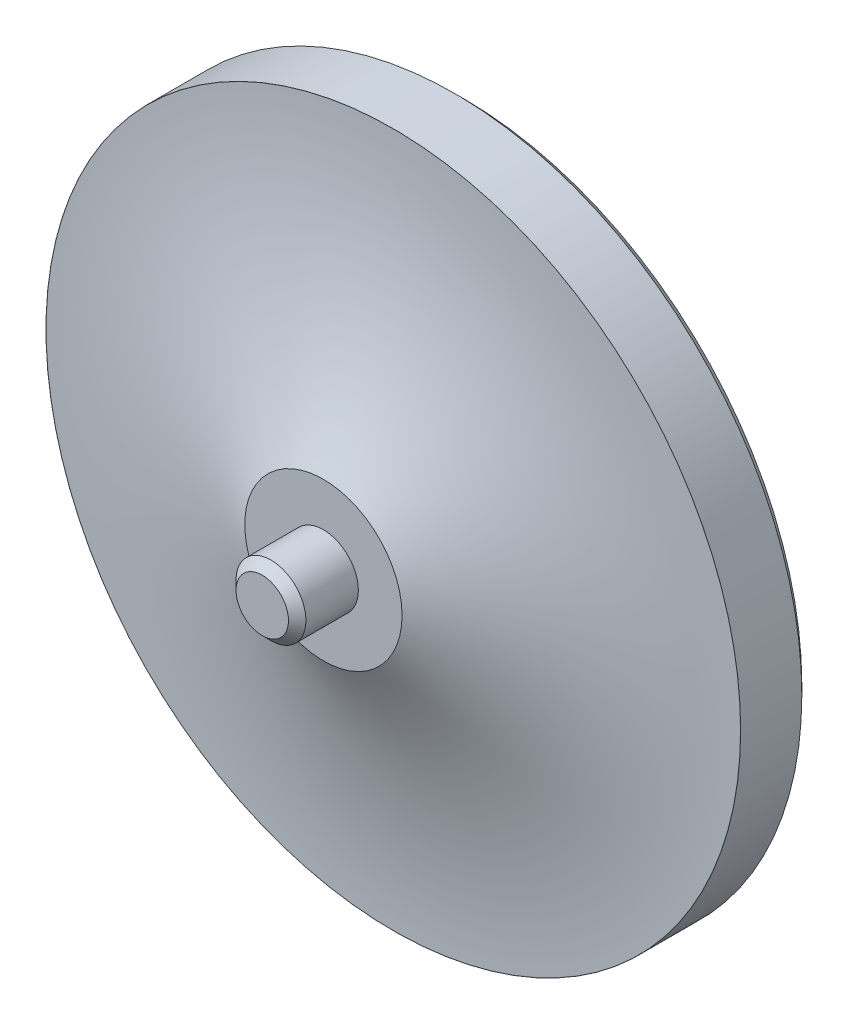
from build123d import *

# Parameters (mm, degrees)
SKETCH1_R           = 39.75
BOSS_EXTRUDE1_DEPTH = 8
CHAMFER1_SIZE       = 1
SKETCH2_R           = 9
SKETCH2_R_2         = 4
BOSS_EXTRUDE2_DEPTH = 8
BOSS_EXTRUDE3_START = 8
SKETCH2_3_R         = 4
BOSS_EXTRUDE3_DEPTH = 7
FILLET1_R           = 63
CHAMFER2_SIZE       = 1


with BuildPart() as part:
    # Sketch1 → Boss-Extrude1 (new body)
    with BuildSketch(Plane.XY):
        Circle(SKETCH1_R)
    extrude(amount=BOSS_EXTRUDE1_DEPTH)

    # Chamfer1
    chamfer1_edges = [part.edges().sort_by_distance(p)[0] for p in [
        (-39.75, 0, 0),
    ]]
    chamfer(chamfer1_edges, length=CHAMFER1_SIZE)

    # Sketch2 → Boss-Extrude2 (add)
    # profile 1 of 2: a face of its own
    with BuildSketch(Plane.XY.offset(8)):
        Circle(SKETCH2_R)
        Circle(SKETCH2_R_2, mode=Mode.SUBTRACT)
    # profile 2 of 2: a face of its own
    with BuildSketch(Plane.XY.offset(8)):
        Circle(SKETCH2_R_2)
    extrude(amount=BOSS_EXTRUDE2_DEPTH)

    # Sketch2<3> → Boss-Extrude3 (add)
    with BuildSketch(Plane.XY.offset(8).offset(BOSS_EXTRUDE3_START)):
        Circle(SKETCH2_3_R)
    extrude(amount=BOSS_EXTRUDE3_DEPTH)

    # Fillet1
    # the kernel refuses this fillet: 63 mm, written as the material it adds along each edge
    with BuildSketch(Plane(origin=(0, 0, 8), x_dir=(1, 0, 0), z_dir=(0, -1, 0))) as fillet1_piece_1:
        with BuildLine():
            CenterArc((39.724582991, 63), FILLET1_R, 240.811017564, 29.188982436)
            Line((9, 8), (9, 0))
            Line((9, 0), (39.724582991, 0))
        make_face()
    revolve(axis=Axis((0, 0, 8), (0, 0, 1)))

    # Chamfer2
    chamfer2_edges = [part.edges().sort_by_distance(p)[0] for p in [
        (-4, 0, 23),
    ]]
    chamfer(chamfer2_edges, length=CHAMFER2_SIZE)


solid = part.part
